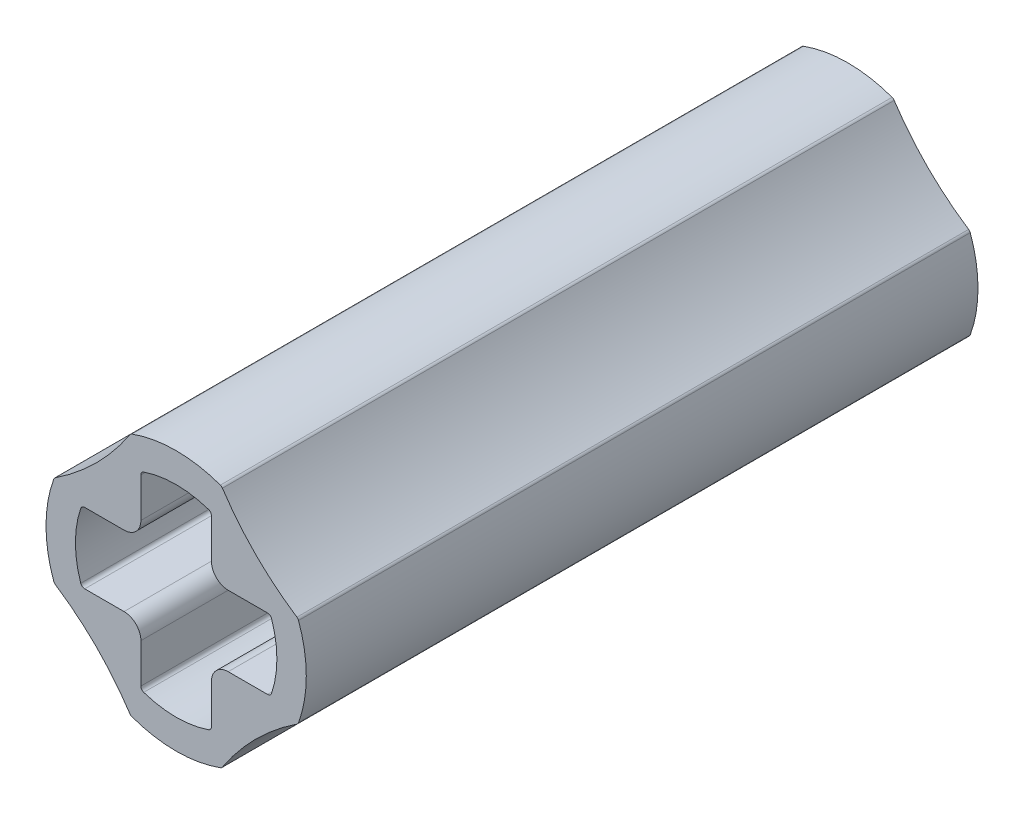
from build123d import *

# Parameters (mm, degrees)
BOSS_EXTRUDE1_DEPTH = 16
CUT_EXTRUDE1_DEPTH  = 16
FILLET1_R           = 0.4
FILLET2_R           = 0.4
FILLET3_R           = 0.4
FILLET4_R           = 0.4
FILLET5_R           = 6.2
FILLET6_R           = 6.2
FILLET7_R           = 6.2
FILLET8_R           = 6.2
FILLET9_R           = 0.1
FILLET10_R          = 0.1
FILLET11_R          = 0.1
FILLET12_R          = 0.1
FILLET13_R          = 0.1
FILLET14_R          = 0.1
FILLET15_R          = 0.1
FILLET16_R          = 0.1
FILLET17_R          = 0.1
FILLET18_R          = 0.1
FILLET19_R          = 0.1
FILLET20_R          = 0.1
FILLET21_R          = 0.1
FILLET22_R          = 0.1
FILLET23_R          = 0.1
FILLET24_R          = 0.1


with BuildPart() as part:
    # Sketch1 → Boss-Extrude1 (new body)
    with BuildSketch(Plane.XY):
        with BuildLine():
            Line((-1.085, -1.085), (-1.085, -2.903924069))
            ThreePointArc((-1.085, -2.903924069), (0, -3.1), (1.085, -2.903924069))
            Line((1.085, -2.903924069), (1.085, -1.085))
            Line((1.085, -1.085), (2.903924069, -1.085))
            ThreePointArc((2.903924069, -1.085), (3.1, 0), (2.903924069, 1.085))
            Line((2.903924069, 1.085), (1.085, 1.085))
            Line((1.085, 1.085), (1.085, 2.903924069))
            ThreePointArc((1.085, 2.903924069), (0, 3.1), (-1.085, 2.903924069))
            Line((-1.085, 2.903924069), (-1.085, 1.085))
            Line((-1.085, 1.085), (-2.903924069, 1.085))
            ThreePointArc((-2.903924069, 1.085), (-3.1, 0), (-2.903924069, -1.085))
            Line((-2.903924069, -1.085), (-1.085, -1.085))
        make_face()
    extrude(amount=BOSS_EXTRUDE1_DEPTH)

    # Sketch2 → Cut-Extrude1 (cut)
    with BuildSketch(Plane.XY):
        with BuildLine():
            Line((0.84, -0.84), (2.248199279, -0.84))
            ThreePointArc((2.248199279, -0.84), (2.4, 0), (2.248199279, 0.84))
            Line((2.248199279, 0.84), (0.84, 0.84))
            Line((0.84, 0.84), (0.84, 2.248199279))
            ThreePointArc((0.84, 2.248199279), (0, 2.4), (-0.84, 2.248199279))
            Line((-0.84, 2.248199279), (-0.84, 0.84))
            Line((-0.84, 0.84), (-2.248199279, 0.84))
            ThreePointArc((-2.248199279, 0.84), (-2.4, 0), (-2.248199279, -0.84))
            Line((-2.248199279, -0.84), (-0.84, -0.84))
            Line((-0.84, -0.84), (-0.84, -2.248199279))
            ThreePointArc((-0.84, -2.248199279), (0, -2.4), (0.84, -2.248199279))
            Line((0.84, -2.248199279), (0.84, -0.84))
        make_face()
    extrude(amount=CUT_EXTRUDE1_DEPTH, mode=Mode.SUBTRACT)

    # Fillet1
    fillet1_edges = [part.edges().sort_by_distance(p)[0] for p in [
        (-0.84, 0.84, 8),
    ]]
    fillet(fillet1_edges, radius=FILLET1_R)

    # Fillet2
    fillet2_edges = [part.edges().sort_by_distance(p)[0] for p in [
        (0.84, 0.84, 8),
    ]]
    fillet(fillet2_edges, radius=FILLET2_R)

    # Fillet3
    fillet3_edges = [part.edges().sort_by_distance(p)[0] for p in [
        (0.84, -0.84, 8),
    ]]
    fillet(fillet3_edges, radius=FILLET3_R)

    # Fillet4
    fillet4_edges = [part.edges().sort_by_distance(p)[0] for p in [
        (-0.84, -0.84, 8),
    ]]
    fillet(fillet4_edges, radius=FILLET4_R)

    # Fillet5
    # the kernel refuses this fillet: 6.2 mm, written as the material it adds along each edge
    with BuildSketch(Plane(origin=(-1.085, 1.085, 0), x_dir=(-1, 0, 0), z_dir=(0, 0, 1))) as fillet5_piece_1:
        with BuildLine():
            CenterArc((5.198154004, -5.198154004), FILLET5_R, 123.027198012, 23.945603977)
            Line((0, -1.818924069), (0, 0))
            Line((0, 0), (1.818924069, 0))
        make_face()
    extrude(amount=16)

    # Fillet6
    # the kernel refuses this fillet: 6.2 mm, written as the material it adds along each edge
    with BuildSketch(Plane(origin=(-1.085, -1.085, 0), x_dir=(-1, 0, 0), z_dir=(0, 0, 1))) as fillet6_piece_1:
        with BuildLine():
            CenterArc((5.198154004, 5.198154004), FILLET6_R, 213.027198012, 23.945603977)
            Line((0, 1.818924069), (0, 0))
            Line((0, 0), (1.818924069, 0))
        make_face()
    extrude(amount=16)

    # Fillet7
    # the kernel refuses this fillet: 6.2 mm, written as the material it adds along each edge
    with BuildSketch(Plane(origin=(1.085, -1.085, 0), x_dir=(0, -1, 0), z_dir=(0, 0, 1))) as fillet7_piece_1:
        with BuildLine():
            CenterArc((5.198154004, 5.198154004), FILLET7_R, 213.027198012, 23.945603977)
            Line((0, 1.818924069), (0, 0))
            Line((0, 0), (1.818924069, 0))
        make_face()
    extrude(amount=16)

    # Fillet8
    # the kernel refuses this fillet: 6.2 mm, written as the material it adds along each edge
    with BuildSketch(Plane(origin=(1.085, 1.085, 0), x_dir=(1, 0, 0), z_dir=(0, 0, 1))) as fillet8_piece_1:
        with BuildLine():
            CenterArc((5.198154004, 5.198154004), FILLET8_R, 213.027198012, 23.945603977)
            Line((0, 1.818924069), (0, 0))
            Line((0, 0), (1.818924069, 0))
        make_face()
    extrude(amount=16)

    # Fillet9
    fillet9_edges = [part.edges().sort_by_distance(p)[0] for p in [
        (0.84, 2.248199279, 8),
    ]]
    fillet(fillet9_edges, radius=FILLET9_R)

    # Fillet10
    fillet10_edges = [part.edges().sort_by_distance(p)[0] for p in [
        (1.085, 2.903924069, 8),
    ]]
    fillet(fillet10_edges, radius=FILLET10_R)

    # Fillet11
    fillet11_edges = [part.edges().sort_by_distance(p)[0] for p in [
        (-1.085, 2.903924069, 8),
    ]]
    fillet(fillet11_edges, radius=FILLET11_R)

    # Fillet12
    fillet12_edges = [part.edges().sort_by_distance(p)[0] for p in [
        (-2.903924069, 1.085, 8),
    ]]
    fillet(fillet12_edges, radius=FILLET12_R)

    # Fillet13
    fillet13_edges = [part.edges().sort_by_distance(p)[0] for p in [
        (-2.903924069, -1.085, 8),
    ]]
    fillet(fillet13_edges, radius=FILLET13_R)

    # Fillet14
    fillet14_edges = [part.edges().sort_by_distance(p)[0] for p in [
        (-1.085, -2.903924069, 8),
    ]]
    fillet(fillet14_edges, radius=FILLET14_R)

    # Fillet15
    fillet15_edges = [part.edges().sort_by_distance(p)[0] for p in [
        (1.085, -2.903924069, 8),
    ]]
    fillet(fillet15_edges, radius=FILLET15_R)

    # Fillet16
    fillet16_edges = [part.edges().sort_by_distance(p)[0] for p in [
        (2.903924069, -1.085, 8),
    ]]
    fillet(fillet16_edges, radius=FILLET16_R)

    # Fillet17
    fillet17_edges = [part.edges().sort_by_distance(p)[0] for p in [
        (2.903924069, 1.085, 8),
    ]]
    fillet(fillet17_edges, radius=FILLET17_R)

    # Fillet18
    fillet18_edges = [part.edges().sort_by_distance(p)[0] for p in [
        (0.84, -2.248199279, 8),
    ]]
    fillet(fillet18_edges, radius=FILLET18_R)

    # Fillet19
    fillet19_edges = [part.edges().sort_by_distance(p)[0] for p in [
        (-0.84, -2.248199279, 8),
    ]]
    fillet(fillet19_edges, radius=FILLET19_R)

    # Fillet20
    fillet20_edges = [part.edges().sort_by_distance(p)[0] for p in [
        (-2.248199279, 0.84, 8),
    ]]
    fillet(fillet20_edges, radius=FILLET20_R)

    # Fillet21
    fillet21_edges = [part.edges().sort_by_distance(p)[0] for p in [
        (-2.248199279, -0.84, 8),
    ]]
    fillet(fillet21_edges, radius=FILLET21_R)

    # Fillet22
    fillet22_edges = [part.edges().sort_by_distance(p)[0] for p in [
        (-0.84, 2.248199279, 8),
    ]]
    fillet(fillet22_edges, radius=FILLET22_R)

    # Fillet23
    fillet23_edges = [part.edges().sort_by_distance(p)[0] for p in [
        (2.248199279, -0.84, 8),
    ]]
    fillet(fillet23_edges, radius=FILLET23_R)

    # Fillet24
    fillet24_edges = [part.edges().sort_by_distance(p)[0] for p in [
        (2.248199279, 0.84, 8),
    ]]
    fillet(fillet24_edges, radius=FILLET24_R)


solid = part.part
